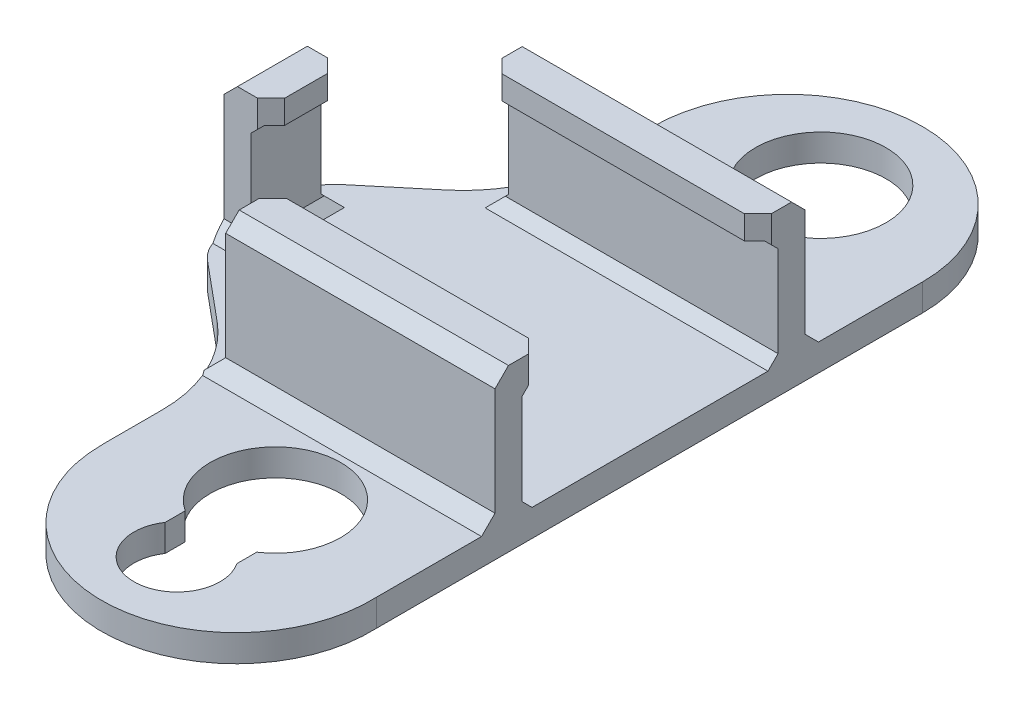
from build123d import *

# Parameters (mm, degrees)
BOSS_EXTRUDE3_DEPTH = 2
SKETCH2_W           = 2
SKETCH2_H           = 5.189750324
SKETCH2_W_2         = 20
SKETCH2_H_2         = 2
BOSS_EXTRUDE4_DEPTH = 10
SKETCH3_W           = 5.189750324
SKETCH3_H           = 1.75
BOSS_EXTRUDE5_DEPTH = 1.5
SKETCH4_W           = 20
SKETCH4_H           = 1.75
BOSS_EXTRUDE6_DEPTH = 1.5
SKETCH5_W           = 20
SKETCH5_H           = 1.75
BOSS_EXTRUDE7_DEPTH = 1.5
CHAMFER1_SIZE       = 0.75
CHAMFER2_SIZE       = 1


with BuildPart() as part:
    # Sketch1 → Boss-Extrude3 (new body)
    with BuildSketch(Plane(origin=(0, 0, 0), x_dir=(1, 0, 0), z_dir=(0, 1, 0))):
        with BuildLine():
            Line((-11.926539406, 14.179618856), (-16.248936601, 10.577621193))
            ThreePointArc((-16.248936601, 10.577621193), (-17.045151666, 9.545423543), (-17.328383402, 8.272957354))
            Line((-17.328383402, 8.272957354), (-17.328383402, 3.08320703))
            ThreePointArc((-17.328383402, 3.08320703), (-17.045151666, 1.810740841), (-16.248936601, 0.778543191))
            Line((-16.248936601, 0.778543191), (-11.926539406, -2.823454472))
            ThreePointArc((-11.926539406, -2.823454472), (-9.27248919, -6.264113306), (-8.328383402, -10.505667268))
            Line((-8.328383402, -10.505667268), (-8.328383402, -14.594989625))
            Line((-8.328383402, -14.594989625), (-8.319708249, -15.011436268))
            ThreePointArc((-8.319708249, -15.011436268), (1.888560246, -25.009267244), (11.671616598, -14.594989625))
            Line((11.671616598, -14.594989625), (11.671616598, -5.821917808))
            Line((11.671616598, -5.821917808), (11.671616598, 17.178082192))
            Line((11.671616598, 17.178082192), (11.671616598, 25.951154008))
            ThreePointArc((11.671616598, 25.951154008), (1.671616598, 35.951154008), (-8.328383402, 25.951154008))
            Line((-8.328383402, 25.951154008), (-8.328383402, 21.861831652))
            ThreePointArc((-8.328383402, 21.861831652), (-9.27248919, 17.620277689), (-11.926539406, 14.179618856))
        make_face()
        with BuildLine():
            ThreePointArc((4.32930425, -16.144178085), (1.671616598, -7.256310151), (-0.986071055, -16.144178085))
            Line((-0.986071055, -16.144178085), (-0.986071055, -17.62452967))
            ThreePointArc((-0.986071055, -17.62452967), (1.671616598, -22.60685858), (4.32930425, -17.62452967))
            Line((4.32930425, -17.62452967), (4.32930425, -16.144178085))
        make_face(mode=Mode.SUBTRACT)
        with BuildLine():
            ThreePointArc((-0.986071055, 22.867739584), (1.671616598, 17.885410674), (4.32930425, 22.867739584))
            Line((4.32930425, 22.867739584), (4.32930425, 24.348091169))
            ThreePointArc((4.32930425, 24.348091169), (1.671616598, 33.235959102), (-0.986071055, 24.348091169))
            Line((-0.986071055, 24.348091169), (-0.986071055, 22.867739584))
        make_face(mode=Mode.SUBTRACT)
    extrude(amount=BOSS_EXTRUDE3_DEPTH)

    # Sketch2 → Boss-Extrude4 (add)
    with BuildSketch(Plane(origin=(0, 2, 0), x_dir=(1, 0, 0), z_dir=(0, 1, 0))):
        with Locations((-16.328383402, 5.678082192)):
            Rectangle(SKETCH2_W, SKETCH2_H)
        with Locations((1.671616598, 16.226428568)):
            Rectangle(SKETCH2_W_2, SKETCH2_H_2)
        with Locations((1.671616598, -4.792288058)):
            Rectangle(SKETCH2_W_2, SKETCH2_H_2)
    extrude(amount=BOSS_EXTRUDE4_DEPTH)

    # Sketch3 → Boss-Extrude5 (add)
    with BuildSketch(Plane(origin=(-15.328383402, 0, 0), x_dir=(0, 0, -1), z_dir=(1, 0, 0))):
        with Locations((5.678082192, 11.125)):
            Rectangle(SKETCH3_W, SKETCH3_H)
    extrude(amount=BOSS_EXTRUDE5_DEPTH)

    # Sketch4 → Boss-Extrude6 (add)
    with BuildSketch(Plane.XY.offset(-15.226428568)):
        with Locations((1.671616598, 11.125)):
            Rectangle(SKETCH4_W, SKETCH4_H)
    extrude(amount=BOSS_EXTRUDE6_DEPTH)

    # Sketch5 → Boss-Extrude7 (add)
    with BuildSketch(Plane(origin=(0, 0, 3.792288058), x_dir=(-1, 0, 0), z_dir=(0, 0, -1))):
        with Locations((-1.671616598, 11.125)):
            Rectangle(SKETCH5_W, SKETCH5_H)
    extrude(amount=BOSS_EXTRUDE7_DEPTH)

    # Chamfer1
    chamfer1_edges = [part.edges().sort_by_distance(p)[0] for p in [
        (-15.328383402, 10.25, -5.678082192),
        (1.671616598, 10.25, -15.226428568),
        (1.671616598, 10.25, 3.792288058),
        (-15.328383402, 2, -5.678082192),
        (1.671616598, 2, -15.226428568),
        (1.671616598, 2, 3.792288058),
    ]]
    chamfer(chamfer1_edges, length=CHAMFER1_SIZE)

    # Chamfer2
    # the kernel refuses this chamfer: 1 mm, written as the material it adds along each edge
    with BuildSketch(Plane(origin=(-12.006700414, 2, -3.08320703), x_dir=(0, 0, 1), z_dir=(-1, 0, 0))) as chamfer2_piece_1_section:
        Polygon((CHAMFER2_SIZE, 0), (0, CHAMFER2_SIZE), (0, 0), align=None)
    chamfer2_piece_1 = extrude(amount=7.893365976, mode=Mode.PRIVATE)
    chamfer2_piece_1 = split(chamfer2_piece_1, bisect_by=Plane(origin=(-15.328383402, 2, -3.08320703), z_dir=(-1, 0, 0)), keep=Keep.TOP, mode=Mode.PRIVATE)
    chamfer2_piece_1 = chamfer2_piece_1 & Plane(origin=(-14.328383402, 2, -3.08320703), x_dir=(-1, 0, 0), z_dir=(0, -1, 0)) * Cylinder(3, 20, mode=Mode.PRIVATE)
    add(chamfer2_piece_1)
    with BuildSketch(Plane(origin=(-12.006700414, 2, -3.08320703), x_dir=(0, 0, 1), z_dir=(-1, 0, 0))) as chamfer2_piece_2_section:
        Polygon((CHAMFER2_SIZE, 0), (0, CHAMFER2_SIZE), (0, 0), align=None)
    chamfer2_piece_2 = extrude(amount=7.893365976, mode=Mode.PRIVATE)
    chamfer2_piece_2 = split(chamfer2_piece_2, bisect_by=Plane(origin=(-15.328383402, 2, -3.08320703), z_dir=(1, 0, 0)), keep=Keep.TOP, mode=Mode.PRIVATE)
    chamfer2_piece_2 = split(chamfer2_piece_2, bisect_by=Plane(origin=(-13.292541908, 0.714158506, -3.08320703), z_dir=(-0.7071067811865476, -0.7071067811865476, 0)), keep=Keep.TOP, mode=Mode.PRIVATE)
    add(chamfer2_piece_2)
    with BuildSketch(Plane(origin=(-19.90006639, 2, -8.272957354), x_dir=(0, 0, -1), z_dir=(1, 0, 0))) as chamfer2_piece_3_section:
        Polygon((CHAMFER2_SIZE, 0), (0, CHAMFER2_SIZE), (0, 0), align=None)
    chamfer2_piece_3 = extrude(amount=7.893365976, mode=Mode.PRIVATE)
    chamfer2_piece_3 = split(chamfer2_piece_3, bisect_by=Plane(origin=(-17.239224896, 4.660841494, -8.272957354), z_dir=(-0.7071067811865476, -0.7071067811865476, 0)), keep=Keep.TOP, mode=Mode.PRIVATE)
    chamfer2_piece_3 = chamfer2_piece_3 & Plane(origin=(-14.328383402, 2, -8.272957354), x_dir=(-0.6401843996644775, 0, -0.7682212795973778), z_dir=(0, -1, 0)) * Cylinder(3, 20, mode=Mode.PRIVATE)
    add(chamfer2_piece_3)
    with BuildSketch(Plane(origin=(-19.90006639, 2, -8.272957354), x_dir=(0, 0, -1), z_dir=(1, 0, 0))) as chamfer2_piece_4_section:
        Polygon((CHAMFER2_SIZE, 0), (0, CHAMFER2_SIZE), (0, 0), align=None)
    chamfer2_piece_4 = extrude(amount=7.893365976, mode=Mode.PRIVATE)
    chamfer2_piece_4 = split(chamfer2_piece_4, bisect_by=Plane(origin=(-15.328383402, 2, -8.272957354), z_dir=(-1, 0, 0)), keep=Keep.TOP, mode=Mode.PRIVATE)
    chamfer2_piece_4 = split(chamfer2_piece_4, bisect_by=Plane(origin=(-17.239224896, 4.660841494, -8.272957354), z_dir=(0.7071067811865476, 0.7071067811865476, 0)), keep=Keep.TOP, mode=Mode.PRIVATE)
    add(chamfer2_piece_4)
    with BuildSketch(Plane(origin=(-8.328383402, 2, -11.90474558), x_dir=(-1, 0, 0), z_dir=(0, 0, -1))) as chamfer2_piece_5_section:
        Polygon((CHAMFER2_SIZE, 0), (0, CHAMFER2_SIZE), (0, 0), align=None)
    chamfer2_piece_5 = extrude(amount=5.321682988, mode=Mode.PRIVATE)
    chamfer2_piece_5 = split(chamfer2_piece_5, bisect_by=Plane(origin=(-8.328383402, 2, -15.226428568), z_dir=(0, 0, -1)), keep=Keep.TOP, mode=Mode.PRIVATE)
    add(chamfer2_piece_5)
    with BuildSketch(Plane(origin=(-8.328383402, 2, -11.90474558), x_dir=(-1, 0, 0), z_dir=(0, 0, -1))) as chamfer2_piece_6_section:
        Polygon((CHAMFER2_SIZE, 0), (0, CHAMFER2_SIZE), (0, 0), align=None)
    chamfer2_piece_6 = extrude(amount=7.893365976, mode=Mode.PRIVATE)
    chamfer2_piece_6 = split(chamfer2_piece_6, bisect_by=Plane(origin=(-8.328383402, 2, -15.226428568), z_dir=(0, 0, 1)), keep=Keep.TOP, mode=Mode.PRIVATE)
    chamfer2_piece_6 = split(chamfer2_piece_6, bisect_by=Plane(origin=(-8.328383402, 0.714158506, -13.190587074), z_dir=(0, -0.7071067811865476, -0.7071067811865476)), keep=Keep.TOP, mode=Mode.PRIVATE)
    add(chamfer2_piece_6)
    with BuildSketch(Plane(origin=(11.671616598, 2, -17.226428568), x_dir=(0, 0, -1), z_dir=(-1, 0, 0))) as chamfer2_piece_7_section:
        Polygon((CHAMFER2_SIZE, 0), (0, -CHAMFER2_SIZE), (0, 0), align=None)
    chamfer2_piece_7 = extrude(amount=20, mode=Mode.PRIVATE)
    chamfer2_piece_7 = chamfer2_piece_7 - Plane(origin=(1.671616598, 2, -21.085410674), x_dir=(-0.8305273914033934, 0, -0.5569777842326162), z_dir=(0, -1, 0)) * Cylinder(3.2, 44, mode=Mode.PRIVATE)
    add(chamfer2_piece_7)
    with BuildSketch(Plane(origin=(-8.328383402, 2, 5.792288058), x_dir=(-1, 0, 0), z_dir=(0, 0, -1))) as chamfer2_piece_8_section:
        Polygon((CHAMFER2_SIZE, 0), (0, CHAMFER2_SIZE), (0, 0), align=None)
    chamfer2_piece_8 = extrude(amount=5.321682988, mode=Mode.PRIVATE)
    chamfer2_piece_8 = split(chamfer2_piece_8, bisect_by=Plane(origin=(-8.328383402, 2, 3.792288058), z_dir=(0, 0, 1)), keep=Keep.TOP, mode=Mode.PRIVATE)
    add(chamfer2_piece_8)
    with BuildSketch(Plane(origin=(-8.328383402, 2, 5.792288058), x_dir=(-1, 0, 0), z_dir=(0, 0, -1))) as chamfer2_piece_9_section:
        Polygon((CHAMFER2_SIZE, 0), (0, CHAMFER2_SIZE), (0, 0), align=None)
    chamfer2_piece_9 = extrude(amount=5.321682988, mode=Mode.PRIVATE)
    chamfer2_piece_9 = split(chamfer2_piece_9, bisect_by=Plane(origin=(-8.328383402, 3.375, 4.417288058), z_dir=(0, -0.7071067811865476, 0.7071067811865476)), keep=Keep.TOP, mode=Mode.PRIVATE)
    add(chamfer2_piece_9)
    with BuildSketch(Plane(origin=(11.671616598, 2, 5.792288058), x_dir=(0, 0, 1), z_dir=(-1, 0, 0))) as chamfer2_piece_10:
        Polygon((CHAMFER2_SIZE, 0), (0, CHAMFER2_SIZE), (0, 0), align=None)
    extrude(amount=20)
    with BuildSketch(Plane(origin=(-8.328383402, 2, -11.90474558), x_dir=(-1, 0, 0), z_dir=(0, 0, -1))) as chamfer2_piece_11a_section:
        Polygon((CHAMFER2_SIZE, 0), (0, CHAMFER2_SIZE), (0, 0), align=None)
    chamfer2_piece_11a = extrude(amount=7.893365976, mode=Mode.PRIVATE)
    chamfer2_piece_11a = chamfer2_piece_11a - Plane(origin=(-18.328383402, 2, -21.861831652), x_dir=(1, 0, 0), z_dir=(0, -1, 0)) * Cylinder(10, 20, mode=Mode.PRIVATE)
    chamfer2_piece_11a = split(chamfer2_piece_11a, bisect_by=Plane(origin=(-8.328383402, 2, -17.226428568), z_dir=(0, 0, -1)), keep=Keep.TOP, mode=Mode.PRIVATE)
    with BuildSketch(Plane(origin=(11.671616598, 2, -17.226428568), x_dir=(0, 0, -1), z_dir=(-1, 0, 0))) as chamfer2_piece_11b_section:
        Polygon((CHAMFER2_SIZE, 0), (0, -CHAMFER2_SIZE), (0, 0), align=None)
    chamfer2_piece_11b = extrude(amount=22.571682988, mode=Mode.PRIVATE)
    chamfer2_piece_11b = chamfer2_piece_11b - Plane(origin=(-18.328383402, 2, -21.861831652), x_dir=(1, 0, 0), z_dir=(0, -1, 0)) * Cylinder(10, 50, mode=Mode.PRIVATE)
    chamfer2_piece_11b = split(chamfer2_piece_11b, bisect_by=Plane(origin=(-8.328383402, 2, -17.226428568), z_dir=(-1, 0, 0)), keep=Keep.TOP, mode=Mode.PRIVATE)
    chamfer2_piece_11 = chamfer2_piece_11a & chamfer2_piece_11b
    add(chamfer2_piece_11)
    with BuildSketch(Plane(origin=(11.671616598, 2, 5.792288058), x_dir=(0, 0, 1), z_dir=(-1, 0, 0))) as chamfer2_piece_12a_section:
        Polygon((CHAMFER2_SIZE, 0), (0, CHAMFER2_SIZE), (0, 0), align=None)
    chamfer2_piece_12a = extrude(amount=22.571682988, mode=Mode.PRIVATE)
    chamfer2_piece_12a = split(chamfer2_piece_12a, bisect_by=Plane(origin=(-8.328383402, 2, 5.792288058), z_dir=(-1, 0, 0)), keep=Keep.TOP, mode=Mode.PRIVATE)
    chamfer2_piece_12a = chamfer2_piece_12a - Plane(origin=(-18.328383402, 2, 10.505667268), x_dir=(0.6401843996644763, 0, -0.7682212795973788), z_dir=(0, -1, 0)) * Cylinder(10, 50, mode=Mode.PRIVATE)
    with BuildSketch(Plane(origin=(-8.328383402, 2, 8.363971046), x_dir=(-1, 0, 0), z_dir=(0, 0, -1))) as chamfer2_piece_12b_section:
        Polygon((CHAMFER2_SIZE, 0), (0, CHAMFER2_SIZE), (0, 0), align=None)
    chamfer2_piece_12b = extrude(amount=7.893365976, mode=Mode.PRIVATE)
    chamfer2_piece_12b = split(chamfer2_piece_12b, bisect_by=Plane(origin=(-8.328383402, 2, 5.792288058), z_dir=(0, 0, 1)), keep=Keep.TOP, mode=Mode.PRIVATE)
    chamfer2_piece_12b = chamfer2_piece_12b - Plane(origin=(-18.328383402, 2, 10.505667268), x_dir=(0.6401843996644763, 0, -0.7682212795973788), z_dir=(0, -1, 0)) * Cylinder(10, 20, mode=Mode.PRIVATE)
    chamfer2_piece_12 = chamfer2_piece_12a & chamfer2_piece_12b
    add(chamfer2_piece_12)
    # the kernel refuses this chamfer: 1 mm, written as the material it takes off along each edge
    with BuildSketch(Plane(origin=(11.671616598, 14.571682988, 2.292288058), x_dir=(-1, 0, 0), z_dir=(0, -1, 0)), Plane(origin=(-13.828383402, 7.678317012, -8.272957354), x_dir=(0, 0, 1), z_dir=(0, 1, 0)), Plane(origin=(-8.328383402, 7.678317012, 2.292288058), x_dir=(1, 0, 0), z_dir=(0, 1, 0))) as chamfer2_2_piece_1:
        Polygon((CHAMFER2_SIZE, 0), (0, -CHAMFER2_SIZE), (0, 0), align=None)
    extrude(amount=6.893365976, mode=Mode.SUBTRACT)
    with BuildSketch(Plane(origin=(11.671616598, 14.571682988, -13.726428568), x_dir=(-1, 0, 0), z_dir=(0, -1, 0)), Plane(origin=(-8.328383402, 7.678317012, -13.726428568), x_dir=(1, 0, 0), z_dir=(0, 1, 0)), Plane(origin=(-13.828383402, 14.571682988, -3.08320703), x_dir=(-1, 0, 0), z_dir=(0, -1, 0))) as chamfer2_2_piece_2:
        Polygon((CHAMFER2_SIZE, 0), (0, CHAMFER2_SIZE), (0, 0), align=None)
    extrude(amount=6.893365976, mode=Mode.SUBTRACT)
    with BuildSketch(Plane(origin=(14.243299586, 12, -17.226428568), x_dir=(0, -1, 0), z_dir=(-1, 0, 0)), Plane(origin=(14.243299586, 12, 5.792288058), x_dir=(0, 0, -1), z_dir=(-1, 0, 0))) as chamfer2_2_piece_3:
        Polygon((CHAMFER2_SIZE, 0), (0, CHAMFER2_SIZE), (0, 0), align=None)
    extrude(amount=25.143365976, mode=Mode.SUBTRACT)
    with BuildSketch(Plane(origin=(-17.328383402, 12, -0.511524042), x_dir=(0, -1, 0), z_dir=(0, 0, -1))) as chamfer2_2_piece_4:
        Polygon((CHAMFER2_SIZE, 0), (0, -CHAMFER2_SIZE), (0, 0), align=None)
    extrude(amount=10.3331163, mode=Mode.SUBTRACT)


solid = part.part
